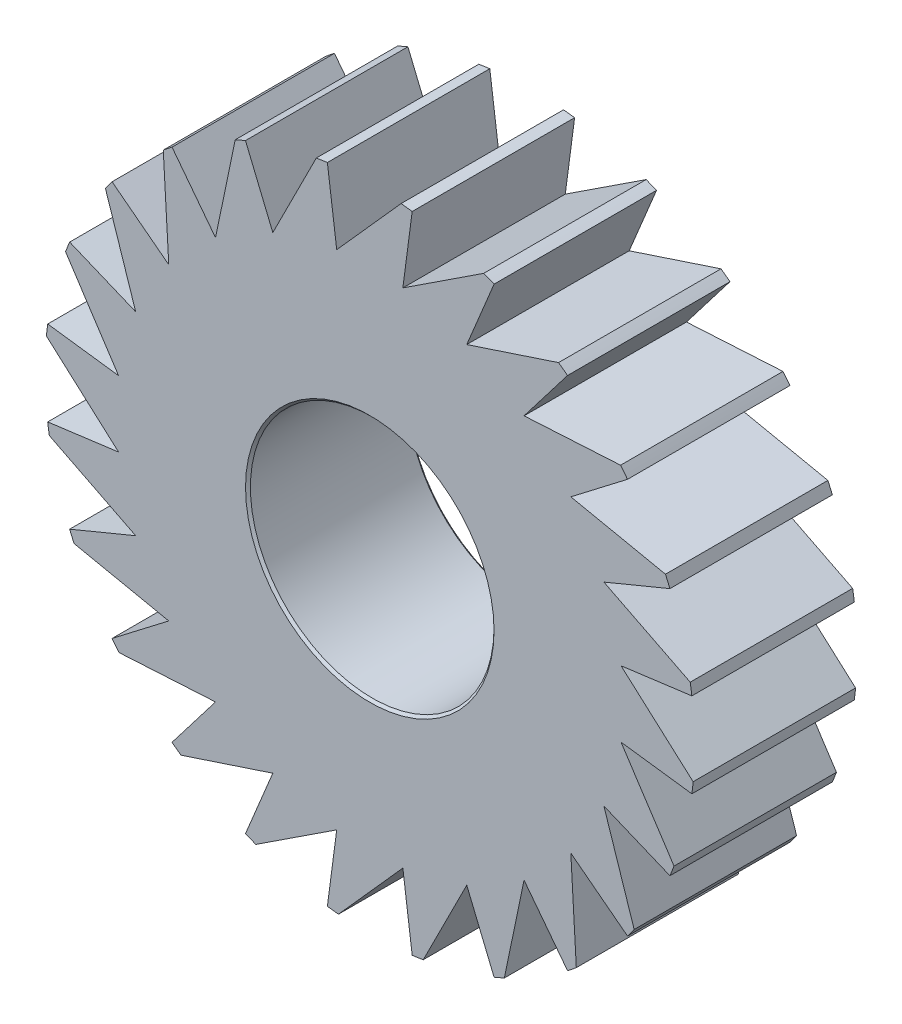
from build123d import *

# Parameters (mm, degrees)
SKETCH1_R               = 9.906
SKETCH1_R_2             = 4.7625
BOSS_EXTRUDE1_DEPTH     = 6.35
BOSS_EXTRUDE2_DEPTH     = 6.35
CIRPATTERN1_COUNT       = 24
CHAMFER1_SIZE           = 0.09525
SKETCH3_R               = 317.5
SKETCH3_R_2             = 12.7
CUT_EXTRUDE_THIN1_DEPTH = 20.746083273


with BuildPart() as part:
    # Sketch1 → Boss-Extrude1 (new body)
    with BuildSketch(Plane.XY):
        Circle(SKETCH1_R)
        Circle(SKETCH1_R_2, mode=Mode.SUBTRACT)
    extrude(amount=-BOSS_EXTRUDE1_DEPTH)

    # Sketch2 → Boss-Extrude2 (add)
    with BuildSketch(Plane.XY):
        with BuildLine():
            Line((-1.29299246, 9.821252797), (1.740566773, 13.220917226))
            Line((1.740566773, 13.220917226), (1.29299246, 9.821252797))
            ThreePointArc((1.29299246, 9.821252797), (0, 9.906), (-1.29299246, 9.821252797))
        make_face()
    boss_extrude2 = extrude(amount=-BOSS_EXTRUDE2_DEPTH)

    # CirPattern1: Boss-Extrude2 ×24 about axis
    cirpattern1_axis = Axis((0, 0, -6.35), (0, 0, 1))
    for i in range(1, CIRPATTERN1_COUNT):
        add(boss_extrude2.rotate(cirpattern1_axis, i * 360 / CIRPATTERN1_COUNT))

    # Chamfer1
    chamfer1_edges = [part.edges().sort_by_distance(p)[0] for p in [
        (-4.7625, 0, -6.35),
        (-4.7625, 0, 0),
    ]]
    chamfer(chamfer1_edges, length=CHAMFER1_SIZE)

    # Sketch3 → Cut-Extrude-Thin1 (cut, through all)
    with BuildSketch(Plane.XY):
        Circle(SKETCH3_R)
        Circle(SKETCH3_R_2, mode=Mode.SUBTRACT)
    extrude(amount=-CUT_EXTRUDE_THIN1_DEPTH, mode=Mode.SUBTRACT)


solid = part.part
